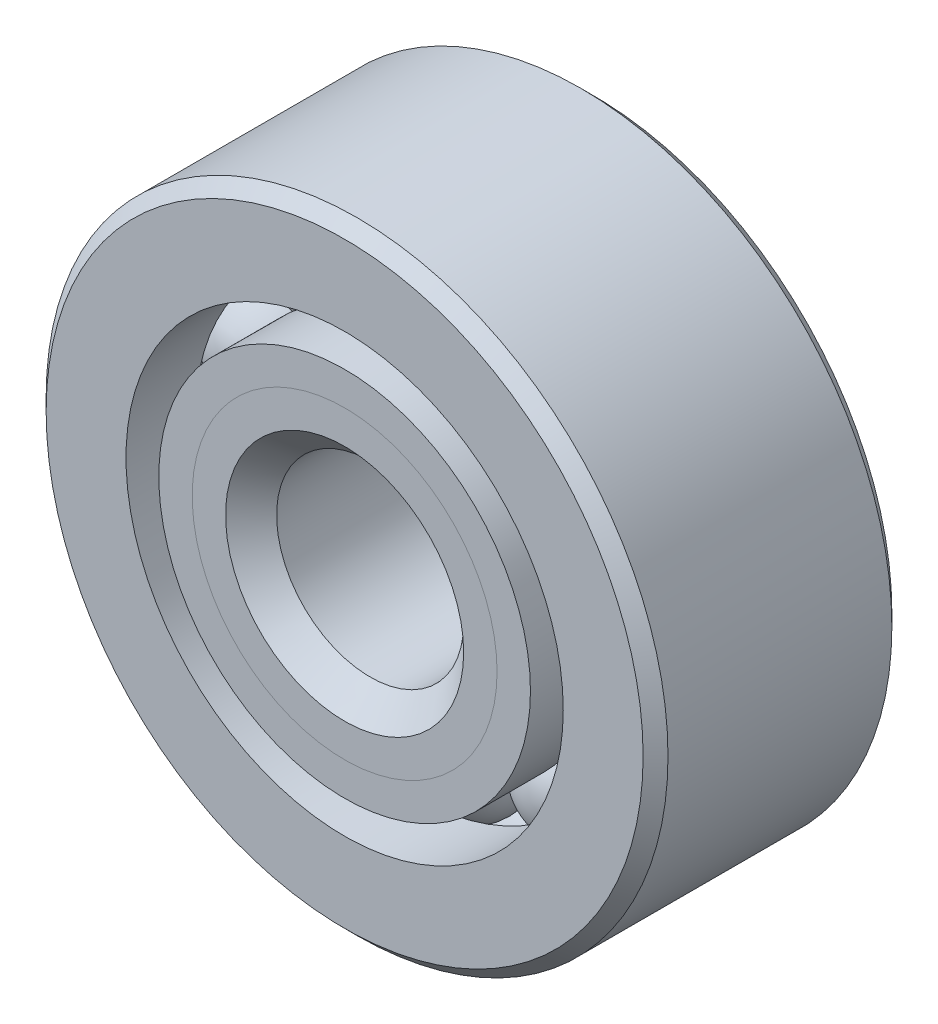
from build123d import *

# Parameters (mm, degrees)
CIRPATTERN1_COUNT = 10


with BuildPart() as part:
    # Sketch1 → Revolve1 (revolve)
    with BuildSketch(Plane(origin=(0, 0, 0), x_dir=(0, 0, -1), z_dir=(1, 0, 0))):
        with BuildLine():
            Line((0.714375, 1.984375), (-0.714375, 1.984375))
            Line((-0.714375, 1.984375), (-0.79375, 1.905))
            Line((-0.79375, 1.905), (-0.79375, 1.39530783))
            Line((-0.79375, 1.39530783), (-0.352777778, 1.39530783))
            ThreePointArc((-0.352777778, 1.39530783), (0, 1.658615812), (0.352777778, 1.39530783))
            Line((0.352777778, 1.39530783), (0.79375, 1.39530783))
            Line((0.79375, 1.39530783), (0.79375, 1.905))
            Line((0.79375, 1.905), (0.714375, 1.984375))
        make_face()
    revolve(axis=Axis((0, 0, 0.79375), (0, 0, -1)))


with BuildPart() as body_2:
    # Sketch2 → Revolve2 (revolve)
    with BuildSketch(Plane(origin=(0, 0, 0), x_dir=(0, 0, -1), z_dir=(1, 0, 0))):
        with BuildLine():
            Line((-0.79375, 1.18596717), (-0.352777778, 1.18596717))
            ThreePointArc((-0.352777778, 1.18596717), (-0.220104097, 0.995743918), (0, 0.922659188))
            Line((0, 0.922659188), (0, 0.759779594))
            Line((0, 0.759779594), (-0.580656212, 0.759779594))
            Line((-0.580656212, 0.759779594), (-0.79375, 0.972873382))
            Line((-0.79375, 0.972873382), (-0.79375, 1.18596717))
        make_face()
    revolve(axis=Axis((0, 0, 0.79375), (0, 0, -1)))


with BuildPart() as body_3:
    # Sketch3 → Revolve3 (revolve)
    with BuildSketch(Plane(origin=(0, 0, 0), x_dir=(0, 0, -1), z_dir=(1, 0, 0))):
        with BuildLine():
            Line((-0.79375, 0.972873382), (-0.580656212, 0.759779594))
            Line((-0.580656212, 0.759779594), (0, 0.759779594))
            Line((0, 0.759779594), (0, 0.922659188))
            ThreePointArc((0, 0.922659188), (0.220104097, 0.995743918), (0.352777778, 1.18596717))
            Line((0.352777778, 1.18596717), (0.79375, 1.18596717))
            Line((0.79375, 1.18596717), (0.79375, 0.676275))
            Line((0.79375, 0.676275), (0.714375, 0.5969))
            Line((0.714375, 0.5969), (-0.630870406, 0.5969))
            Line((-0.630870406, 0.5969), (-0.79375, 0.759779594))
            Line((-0.79375, 0.759779594), (-0.79375, 0.972873382))
        make_face()
    revolve(axis=Axis((0, 0, 0.79375), (0, 0, -1)))


with BuildPart() as body_4:
    # Sketch4 → Revolve4 (revolve)
    with BuildSketch(Plane(origin=(0, 0, 0), x_dir=(0, 0, -1), z_dir=(1, 0, 0))):
        with BuildLine():
            Line((-0.367978312, 1.2906375), (0.367978312, 1.2906375))
            ThreePointArc((0.367978312, 1.2906375), (0, 1.658615812), (-0.367978312, 1.2906375))
        make_face()
    revolve(axis=Axis((0, 1.2906375, 0.367978312), (0, 0, -1)))


with BuildPart() as cirpattern1_1:
    # CirPattern1: pattern copy
    add(body_4.part.rotate(Axis((0, 0, -0.79375), (0, 0, 1)), 1 * 360 / CIRPATTERN1_COUNT))


with BuildPart() as cirpattern1_2:
    # CirPattern1: pattern copy
    add(body_4.part.rotate(Axis((0, 0, -0.79375), (0, 0, 1)), 2 * 360 / CIRPATTERN1_COUNT))


with BuildPart() as cirpattern1_3:
    # CirPattern1: pattern copy
    add(body_4.part.rotate(Axis((0, 0, -0.79375), (0, 0, 1)), 3 * 360 / CIRPATTERN1_COUNT))


with BuildPart() as cirpattern1_4:
    # CirPattern1: pattern copy
    add(body_4.part.rotate(Axis((0, 0, -0.79375), (0, 0, 1)), 4 * 360 / CIRPATTERN1_COUNT))


with BuildPart() as cirpattern1_5:
    # CirPattern1: pattern copy
    add(body_4.part.rotate(Axis((0, 0, -0.79375), (0, 0, 1)), 5 * 360 / CIRPATTERN1_COUNT))


with BuildPart() as cirpattern1_6:
    # CirPattern1: pattern copy
    add(body_4.part.rotate(Axis((0, 0, -0.79375), (0, 0, 1)), 6 * 360 / CIRPATTERN1_COUNT))


with BuildPart() as cirpattern1_7:
    # CirPattern1: pattern copy
    add(body_4.part.rotate(Axis((0, 0, -0.79375), (0, 0, 1)), 7 * 360 / CIRPATTERN1_COUNT))


with BuildPart() as cirpattern1_8:
    # CirPattern1: pattern copy
    add(body_4.part.rotate(Axis((0, 0, -0.79375), (0, 0, 1)), 8 * 360 / CIRPATTERN1_COUNT))


with BuildPart() as cirpattern1_9:
    # CirPattern1: pattern copy
    add(body_4.part.rotate(Axis((0, 0, -0.79375), (0, 0, 1)), 9 * 360 / CIRPATTERN1_COUNT))


solid = Compound([part.part, body_2.part, body_3.part, body_4.part, cirpattern1_1.part, cirpattern1_2.part, cirpattern1_3.part, cirpattern1_4.part, cirpattern1_5.part, cirpattern1_6.part, cirpattern1_7.part, cirpattern1_8.part, cirpattern1_9.part])
